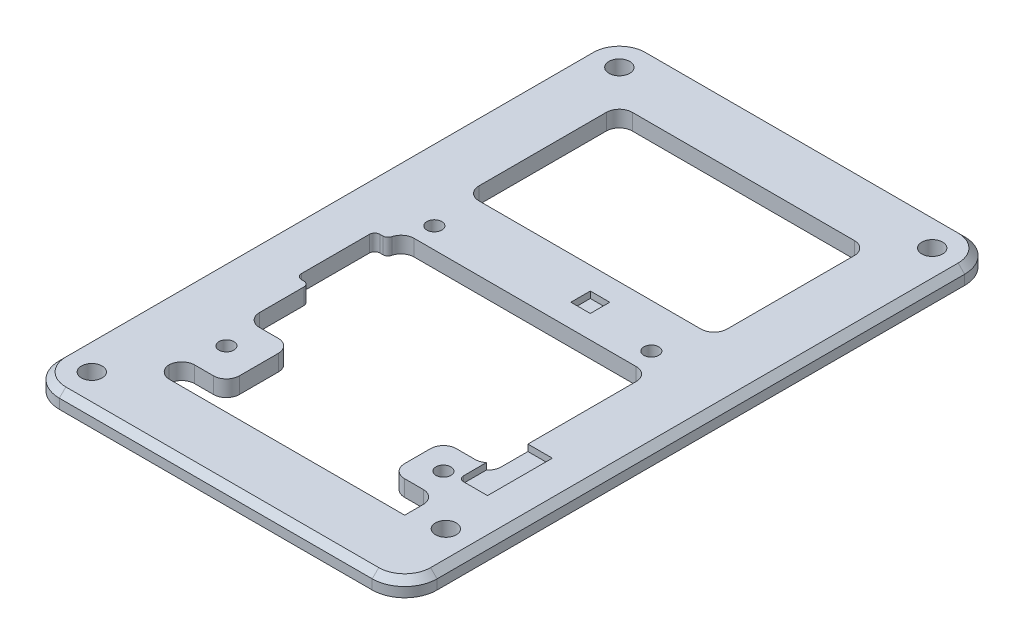
from build123d import *

# Parameters (mm, degrees)
SKETCH5_W           = 58.25
SKETCH5_H           = 91.35
SKETCH5_R           = 1.15
SKETCH5_R_2         = 1.6
SKETCH5_W_2         = 38.25
SKETCH5_H_2         = 23.65
BOSS_EXTRUDE1_DEPTH = 2.5
SKETCH8_W           = 4.5
SKETCH8_H           = 10
SKETCH8_W_2         = 3
SKETCH8_H_2         = 3
CUT_EXTRUDE1_DEPTH  = 1
FILLET1_R           = 2
FILLET2_R           = 5
SKETCH9_W           = 6.8
SKETCH9_H           = 12.1
CUT_EXTRUDE2_DEPTH  = 55.228417366
SKETCH10_W          = 7.2
SKETCH10_H          = 5.49
CUT_EXTRUDE3_DEPTH  = 1
FILLET3_R           = 0.8
CHAMFER3_SIZE       = 1


with BuildPart() as part:
    # Sketch5 → Boss-Extrude1 (new body)
    with BuildSketch(Plane(origin=(0, 0, 0), x_dir=(1, 0, 0), z_dir=(0, 1, 0))):
        Rectangle(SKETCH5_W, SKETCH5_H)
        with Locations(Location((-17.23, 5.255, 0), (0, 0, 270))):
            Circle(SKETCH5_R, mode=Mode.SUBTRACT)
        with Locations(Location((-24.125, 40.675, 0), (0, 0, 270))):
            Circle(SKETCH5_R_2, mode=Mode.SUBTRACT)
        with Locations(Location((-24.125, -40.675, 0), (0, 0, 270))):
            Circle(SKETCH5_R_2, mode=Mode.SUBTRACT)
        with Locations(Location((24.125, -34.325, 0), (0, 0, 270))):
            Circle(SKETCH5_R_2, mode=Mode.SUBTRACT)
        with Locations(Location((24.125, 40.675, 0), (0, 0, 270))):
            Circle(SKETCH5_R_2, mode=Mode.SUBTRACT)
        with Locations(Location((16.23, 5.255, 0), (0, 0, 270))):
            Circle(SKETCH5_R, mode=Mode.SUBTRACT)
        with Locations(Location((16.23, -26.805, 0), (0, 0, 270))):
            Circle(SKETCH5_R, mode=Mode.SUBTRACT)
        with Locations(Location((-17.23, -26.805, 0), (0, 0, 270))):
            Circle(SKETCH5_R, mode=Mode.SUBTRACT)
        Polygon((-19.125, 2.025), (19.125, 2.025), (19.125, -22.805), (12.23, -22.805), (12.23, -30.805), (19.125, -30.805), (19.125, -35.675), (-19.125, -35.675), (-19.125, -31.805), (-12.23, -31.805), (-12.23, -21.805), (-19.125, -21.805), align=None, mode=Mode.SUBTRACT)
        with Locations((0, 23.85)):
            Rectangle(SKETCH5_W_2, SKETCH5_H_2, mode=Mode.SUBTRACT)
    extrude(amount=BOSS_EXTRUDE1_DEPTH)

    # Sketch8 → Cut-Extrude1 (cut)
    with BuildSketch(Plane(origin=(0, 2.5, 0), x_dir=(1, 0, 0), z_dir=(0, 1, 0))):
        with Locations((20.65, -21.675)):
            Rectangle(SKETCH8_W, SKETCH8_H)
        with Locations((5, 7.075)):
            Rectangle(SKETCH8_W_2, SKETCH8_H_2)
    extrude(amount=-CUT_EXTRUDE1_DEPTH, mode=Mode.SUBTRACT)

    # Fillet1
    # the kernel refuses this fillet: 2 mm, written as the material it adds along each edge
    with BuildSketch(Plane(origin=(19.125, 0, -12.025), x_dir=(0, 0, -1), z_dir=(0, 1, 0)), Plane(origin=(19.125, 0, -35.675), x_dir=(-1, 0, 0), z_dir=(0, 1, 0)), Plane(origin=(-19.125, 0, -35.675), x_dir=(0, 0, 1), z_dir=(0, 1, 0)), Plane(origin=(19.125, 0, -2.025), x_dir=(-1, 0, 0), z_dir=(0, 1, 0)), Plane(origin=(-19.125, 0, 21.805), x_dir=(1, 0, 0), z_dir=(0, 1, 0)), Plane(origin=(19.125, 0, 30.805), x_dir=(-1, 0, 0), z_dir=(0, 1, 0)), Plane(origin=(-19.125, 0, 31.805), x_dir=(0, 0, 1), z_dir=(0, 1, 0)), Plane(origin=(-19.125, 0, 35.675), x_dir=(1, 0, 0), z_dir=(0, 1, 0))) as fillet1_piece_1:
        with BuildLine():
            CenterArc((FILLET1_R, FILLET1_R), FILLET1_R, 180, 90)
            Line((0, FILLET1_R), (0, 0))
            Line((0, 0), (FILLET1_R, 0))
        make_face()
    extrude(amount=2.5)
    with BuildSketch(Plane(origin=(-19.125, 0, -12.025), x_dir=(0, 0, -1), z_dir=(0, 1, 0)), Plane(origin=(-19.125, 0, -2.025), x_dir=(1, 0, 0), z_dir=(0, 1, 0))) as fillet1_piece_2:
        with BuildLine():
            CenterArc((FILLET1_R, -FILLET1_R), FILLET1_R, 90, 90)
            Line((0, -FILLET1_R), (0, 0))
            Line((0, 0), (FILLET1_R, 0))
        make_face()
    extrude(amount=2.5)
    with BuildSketch(Plane(origin=(19.125, 0, 22.805), x_dir=(0, 0, -1), z_dir=(0, 1, 0))) as fillet1_piece_3_section:
        with BuildLine():
            CenterArc((FILLET1_R, FILLET1_R), FILLET1_R, 180, 90)
            Line((0, FILLET1_R), (0, 0))
            Line((0, 0), (FILLET1_R, 0))
        make_face()
    fillet1_piece_3 = extrude(amount=1.5, mode=Mode.PRIVATE)
    fillet1_piece_3 = split(fillet1_piece_3, bisect_by=Plane(origin=(18.4, 0.75, 22.246257115), z_dir=(1, 0, 0)), keep=Keep.TOP, mode=Mode.PRIVATE)
    add(fillet1_piece_3)
    with BuildSketch(Plane(origin=(19.125, 0, 22.805), x_dir=(0, 0, -1), z_dir=(0, 1, 0))) as fillet1_piece_4_section:
        with BuildLine():
            CenterArc((FILLET1_R, FILLET1_R), FILLET1_R, 180, 90)
            Line((0, FILLET1_R), (0, 0))
            Line((0, 0), (FILLET1_R, 0))
        make_face()
    fillet1_piece_4 = extrude(amount=1.5, mode=Mode.PRIVATE)
    fillet1_piece_4 = split(fillet1_piece_4, bisect_by=Plane(origin=(18.4, 0.75, 22.70384679), z_dir=(-1, 0, 0)), keep=Keep.TOP, mode=Mode.PRIVATE)
    add(fillet1_piece_4)
    with BuildSketch(Plane(origin=(19.125, 0, 22.805), x_dir=(0, 0, -1), z_dir=(0, 1, 0))) as fillet1_piece_5_section:
        with BuildLine():
            CenterArc((FILLET1_R, FILLET1_R), FILLET1_R, 180, 90)
            Line((0, FILLET1_R), (0, 0))
            Line((0, 0), (FILLET1_R, 0))
        make_face()
    fillet1_piece_5 = extrude(amount=6.5, mode=Mode.PRIVATE)
    fillet1_piece_5 = split(fillet1_piece_5, bisect_by=Plane(origin=(18.018520093, 2.5, 22.70384679), z_dir=(0, -1, 0)), keep=Keep.TOP, mode=Mode.PRIVATE)
    fillet1_piece_5 = split(fillet1_piece_5, bisect_by=Plane(origin=(18.018520093, 1.5, 22.70384679), z_dir=(0, 1, 0)), keep=Keep.TOP, mode=Mode.PRIVATE)
    fillet1_piece_5 = split(fillet1_piece_5, bisect_by=Plane(origin=(18.4, 2, 22.70384679), z_dir=(-1, 0, 0)), keep=Keep.TOP, mode=Mode.PRIVATE)
    add(fillet1_piece_5)
    # the kernel refuses this fillet: 2 mm, written as the material it takes off along each edge
    with BuildSketch(Plane(origin=(12.23, -5, 30.805), x_dir=(1, 0, 0), z_dir=(0, 1, 0)), Plane(origin=(12.23, -5, 22.805), x_dir=(0, 0, 1), z_dir=(0, 1, 0)), Plane(origin=(-12.23, -5, 31.805), x_dir=(0, 0, -1), z_dir=(0, 1, 0)), Plane(origin=(-12.23, -5, 21.805), x_dir=(-1, 0, 0), z_dir=(0, 1, 0))) as fillet1_2_piece_1:
        with BuildLine():
            CenterArc((FILLET1_R, FILLET1_R), FILLET1_R, 180, 90)
            Line((0, FILLET1_R), (0, 0))
            Line((0, 0), (FILLET1_R, 0))
        make_face()
    extrude(amount=12.5, mode=Mode.SUBTRACT)

    # Fillet2
    fillet2_edges = [part.edges().sort_by_distance(p)[0] for p in [
        (29.125, 1.25, -45.675),
        (29.125, 1.25, 45.675),
        (-29.125, 1.25, 45.675),
        (-29.125, 1.25, -45.675),
    ]]
    fillet(fillet2_edges, radius=FILLET2_R)

    # Sketch9 → Cut-Extrude2 (cut, through all)
    with BuildSketch(Plane.XZ):
        with Locations((-17.7, 6.125)):
            Rectangle(SKETCH9_W, SKETCH9_H)
    extrude(amount=-CUT_EXTRUDE2_DEPTH, mode=Mode.SUBTRACT)

    # Sketch10 → Cut-Extrude3 (cut)
    with BuildSketch(Plane(origin=(0, 0, 0), x_dir=(1, 0, 0), z_dir=(0, 1, 0))):
        with Locations((0.325, 6.42)):
            Rectangle(SKETCH10_W, SKETCH10_H)
    extrude(amount=CUT_EXTRUDE3_DEPTH, mode=Mode.SUBTRACT)

    # Fillet3
    fillet3_edges = [part.edges().sort_by_distance(p)[0] for p in [
        (-19.125, 1.25, 12.175),
        (-21.1, 1.25, 12.175),
        (-19.125, 1.25, 0.075),
        (-21.1, 1.25, 0.075),
        (3.925, 0.5, -3.675),
        (3.925, 0.5, -9.165),
        (-3.275, 0.5, -9.165),
        (-3.275, 0.5, -3.675),
        (18.4, 2, 26.675),
    ]]
    fillet(fillet3_edges, radius=FILLET3_R)

    # Chamfer3
    chamfer3_edges = [part.edges().sort_by_distance(p)[0] for p in [
        (29.125, 2.5, 0),
        (0, 2.5, 45.675),
        (0, 2.5, -45.675),
        (-29.125, 2.5, 0),
        (27.660533906, 2.5, -44.210533906),
        (-27.660533906, 2.5, -44.210533906),
        (-27.660533906, 2.5, 44.210533906),
        (27.660533906, 2.5, 44.210533906),
    ]]
    chamfer(chamfer3_edges, length=CHAMFER3_SIZE)


solid = part.part
